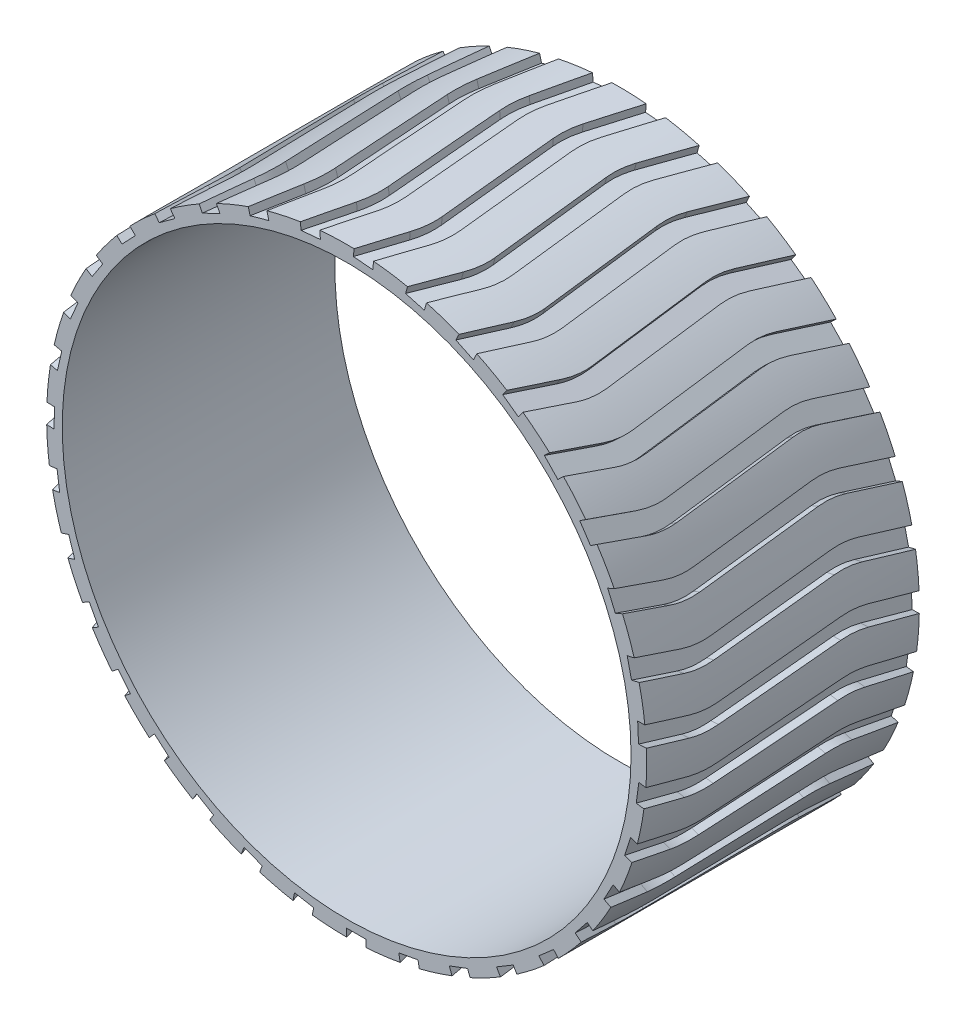
from build123d import *

# Parameters (mm, degrees)
SKETCH1_R           = 77
SKETCH1_R_2         = 73
BOSS_EXTRUDE1_DEPTH = 70
CUT_EXTRUDE2_START  = -75
CUT_EXTRUDE2_DEPTH  = 5
CIRPATTERN1_COUNT   = 35


with BuildPart() as part:
    # Sketch1 → Boss-Extrude1 (new body)
    with BuildSketch(Plane.XY):
        Circle(SKETCH1_R)
        Circle(SKETCH1_R_2, mode=Mode.SUBTRACT)
    extrude(amount=BOSS_EXTRUDE1_DEPTH)

    # Sketch3 → Cut-Extrude2 (cut)
    with BuildSketch(Plane(origin=(0, 0, 0), x_dir=(1, 0, 0), z_dir=(0, 1, 0)).offset(CUT_EXTRUDE2_START)):
        with BuildLine():
            Line((0, 0), (-5, 0))
            Line((-5, 0), (-1.516285962, -13.065767489))
            ThreePointArc((-1.516285962, -13.065767489), (-0.91043708, -16.555192838), (-0.929573095, -20.09677101))
            Line((-0.929573095, -20.09677101), (-3.900263922, -51.586497948))
            ThreePointArc((-3.900263922, -51.586497948), (-3.898799409, -55.358813792), (-3.189013733, -59.063752829))
            Line((-3.189013733, -59.063752829), (0, -70))
            Line((0, -70), (5, -70))
            Line((5, -70), (1.74312847, -58.831044631))
            ThreePointArc((1.74312847, -58.831044631), (1.033342794, -55.126105594), (1.031878281, -51.35378975))
            Line((1.031878281, -51.35378975), (4.00408781, -19.847964367))
            ThreePointArc((4.00408781, -19.847964367), (4.023223824, -16.306386195), (3.417374943, -12.816960845))
            Line((3.417374943, -12.816960845), (0, 0))
        make_face()
    cut_extrude2 = extrude(amount=-CUT_EXTRUDE2_DEPTH, mode=Mode.SUBTRACT)

    # CirPattern1: Cut-Extrude2 ×35 about axis
    cirpattern1_axis = Axis((0, 0, 70), (0, 0, -1))
    for i in range(1, CIRPATTERN1_COUNT):
        add(cut_extrude2.rotate(cirpattern1_axis, i * 360 / CIRPATTERN1_COUNT), mode=Mode.SUBTRACT)


solid = part.part
